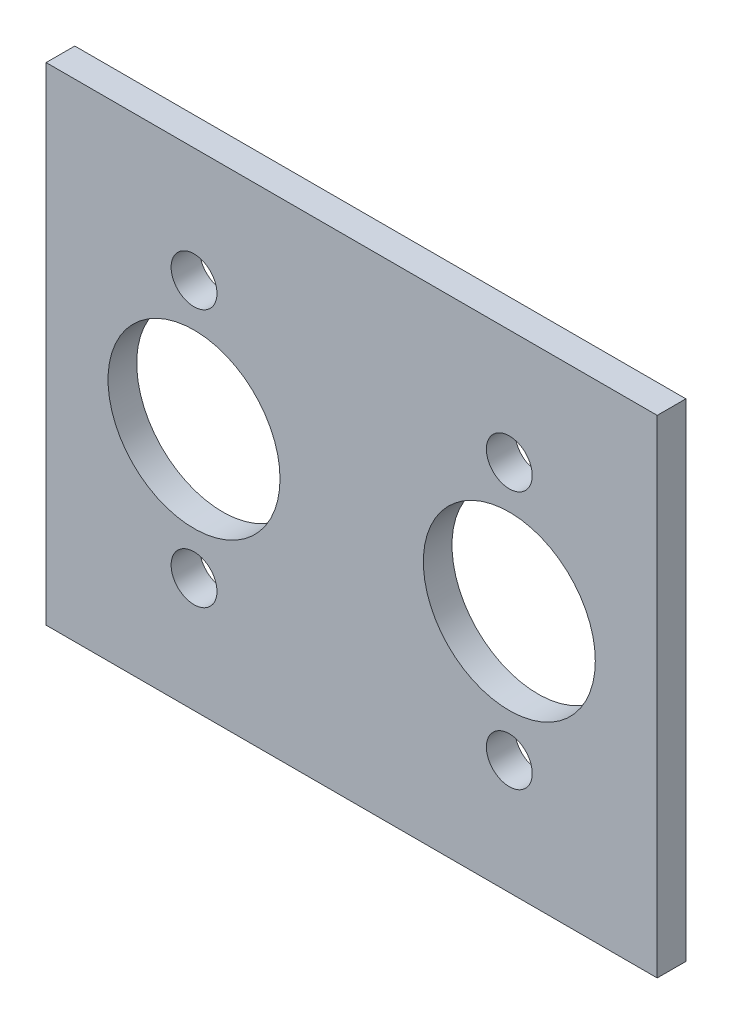
from build123d import *

# Parameters (mm, degrees)
SZKIC1_W                   = 106.6
SZKIC1_H                   = 85
ODGI_CIE_BAZOWE1_DEPTH     = 5
SZKIC6_R                   = 15
SZKIC6_R_2                 = 4
WYTNIJ_WYCI_GNI_CIE1_DEPTH = 69.353054065


# Sheet-metal steps are written as plain solids
with BuildPart() as part:
    # Szkic1 → Odgięcie bazowe1 (new body)
    with BuildSketch(Plane.XY):
        Rectangle(SZKIC1_W, SZKIC1_H)
    extrude(amount=-ODGI_CIE_BAZOWE1_DEPTH)

    # Szkic6 → Wytnij-wyciągnięcie1 (cut, through all)
    with BuildSketch(Plane.XY):
        with Locations((-27.5, 0)):
            Circle(SZKIC6_R)
        with Locations((27.5, 0)):
            Circle(SZKIC6_R)
        with Locations((-27.5, 22.5)):
            Circle(SZKIC6_R_2)
        with Locations((27.5, 22.5)):
            Circle(SZKIC6_R_2)
        with Locations((27.5, -22.5)):
            Circle(SZKIC6_R_2)
        with Locations((-27.5, -22.5)):
            Circle(SZKIC6_R_2)
    extrude(amount=-WYTNIJ_WYCI_GNI_CIE1_DEPTH, mode=Mode.SUBTRACT)


solid = part.part
